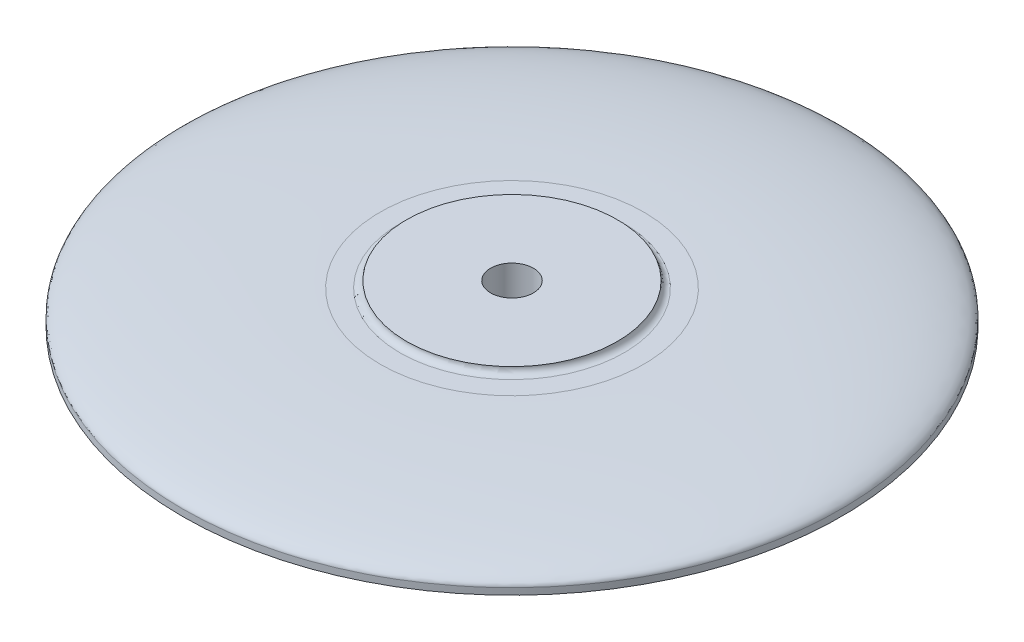
from build123d import *

# Parameters (mm, degrees)
SKETCH1_R           = 50
BOSS_EXTRUDE1_DEPTH = 5
SKETCH2_R           = 16
BOSS_EXTRUDE2_DEPTH = 1
SKETCH3_R           = 3.25
CUT_EXTRUDE1_DEPTH  = 71.964779997
FILLET1_R           = 1
FILLET2_SIZE        = 30
FILLET2_SIZE_2      = 4


# Some blends are built 0.0001 mm under size
with BuildPart() as part:
    # Sketch1 → Boss-Extrude1 (new body)
    with BuildSketch(Plane(origin=(0, 0, 0), x_dir=(1, 0, 0), z_dir=(0, 1, 0))):
        with Locations(Location((0, 0, 0), (0, 0, 270))):
            Circle(SKETCH1_R)
    extrude(amount=BOSS_EXTRUDE1_DEPTH)

    # Sketch2 → Boss-Extrude2 (add)
    with BuildSketch(Plane(origin=(0, 5, 0), x_dir=(1, 0, 0), z_dir=(0, 1, 0))):
        with Locations(Location((0, 0, 0), (0, 0, 270))):
            Circle(SKETCH2_R)
    extrude(amount=BOSS_EXTRUDE2_DEPTH)

    # Sketch3 → Cut-Extrude1 (cut, through all)
    with BuildSketch(Plane(origin=(0, 6, 0), x_dir=(1, 0, 0), z_dir=(0, 1, 0))):
        with Locations(Location((0, 0, 0), (0, 0, 270))):
            Circle(SKETCH3_R)
    extrude(amount=-CUT_EXTRUDE1_DEPTH, mode=Mode.SUBTRACT)

    # Fillet1
    fillet1_edges = [part.edges().sort_by_distance(p)[0] for p in [
        (0, 5, -16),
    ]]
    fillet(fillet1_edges, radius=FILLET1_R - 0.0001)  # a hair under: the kernel refuses the full size

    # Fillet2
    # an asymmetric fillet: 30, 4 mm, written as the material it takes off along each edge
    with BuildSketch(Plane(origin=(0, 5, 0), x_dir=(0, 0, 1), z_dir=(-1, 0, 0))) as fillet2_piece_1:
        with BuildLine():
            Bezier((50 - FILLET2_SIZE, 0), (50, 0), (50, -FILLET2_SIZE_2), weights=[1, 0.707106781, 1])
            Line((50, -FILLET2_SIZE_2), (50, 0))
            Line((50, 0), (50 - FILLET2_SIZE, 0))
        make_face()
    revolve(axis=Axis((0, 5, 0), (0, 1, 0)), mode=Mode.SUBTRACT)


solid = part.part
